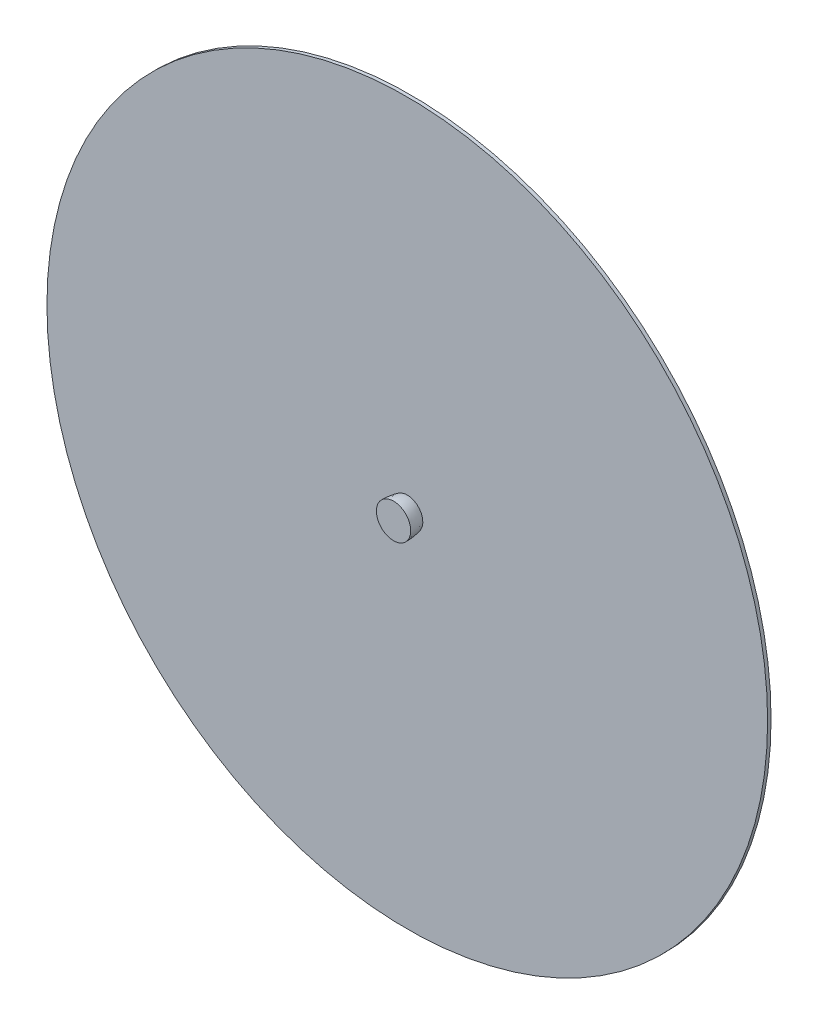
from build123d import *

# Parameters (mm, degrees)
ESBO_O3_R                = 1050
RESSALTO_EXTRUS_O2_DEPTH = 10


with BuildPart() as part:
    # Esboço1 → Revolução1 (revolve)
    with BuildSketch(Plane(origin=(0, 0, 0), x_dir=(1, 0, 0), z_dir=(0, 1, 0))):
        with BuildLine():
            Line((0, 50), (0, -50))
            Line((0, -50), (-50, -50))
            add(Edge.make_bspline(
                [(-50, -50), (-50, -12.744944478), (-39.795138956, 37.374588978), (0, 50)],
                knots=[0, 0, 0, 0, 1, 1, 1, 1], degree=3))
        make_face()
    revolve(axis=Axis((0, 0, -124.438202247), (0, 0, 1)))


with BuildPart() as body_2:
    # Esboço3 → Ressalto-extrusão2 (new body)
    with BuildSketch(Plane.XY):
        Circle(ESBO_O3_R)
    extrude(amount=RESSALTO_EXTRUS_O2_DEPTH)


solid = Compound([part.part, body_2.part])
